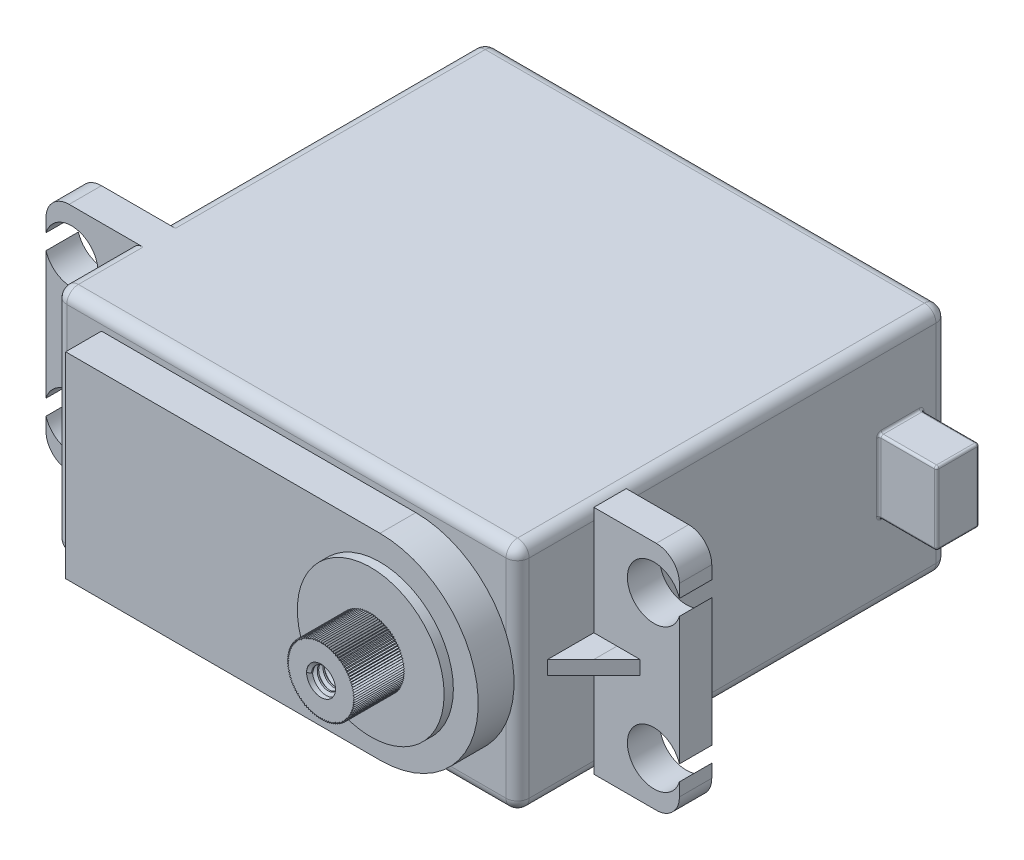
from build123d import *
from build123d.topology import SkipClean

# Parameters (mm, degrees)
SKETCH1_W            = 40
SKETCH1_H            = 20
BOSS_EXTRUDE1_DEPTH  = 37.2
SKETCH2_W            = 2.8
SKETCH2_H            = 20
BOSS_EXTRUDE2_DEPTH  = 7.4
SKETCH3_R            = 2.3
CUT_EXTRUDE1_DEPTH   = 43.274342
FILLET1_R            = 2
RIB5_OUTLINE_W       = 4
RIB5_OUTLINE_H       = 1.2
RIB5_DEPTH           = 4
CUT_EXTRUDE2_DEPTH   = 48.40211
SKETCH6_W            = 3.7
SKETCH6_H            = 6.3
BOSS_EXTRUDE3_DEPTH  = 5
FILLET3_R            = 1
BOSS_EXTRUDE4_DEPTH  = 3.1
SKETCH8_R            = 6.35
BOSS_EXTRUDE5_DEPTH  = 0.8
BOSS_EXTRUDE6_DEPTH  = 4.3
SKETCH10_R           = 1.25
CUT_EXTRUDE3_DEPTH   = 6
THREAD1_PITCH        = 0.5
FILLET1_OF_MIRROR1_R = 2
FILLET4_R            = 0.2


# Read off the part's stored shape, not the designer's step: Rib5
with BuildPart() as part:
    # Sketch1 → Boss-Extrude1 (new body)
    with BuildSketch(Plane.XY):
        Rectangle(SKETCH1_W, SKETCH1_H)
    extrude(amount=BOSS_EXTRUDE1_DEPTH)

    # Sketch2 → Boss-Extrude2 (add)
    with BuildSketch(Plane.ZY.offset(20)):
        with Locations((29.2, 0)):
            Rectangle(SKETCH2_W, SKETCH2_H)
    boss_extrude2 = extrude(amount=BOSS_EXTRUDE2_DEPTH)

    # Sketch3 → Cut-Extrude1 (cut, through all)
    with BuildSketch(Plane.XY.offset(30.6)):
        with Locations((-25.2, 6.2)):
            Circle(SKETCH3_R)
        with Locations((-25.2, -6.2)):
            Circle(SKETCH3_R)
    cut_extrude1 = extrude(amount=-CUT_EXTRUDE1_DEPTH, mode=Mode.SUBTRACT)

    # Fillet1
    fillet1_edges = [part.edges().sort_by_distance(p)[0] for p in [
        (-27.4, -10, 29.2),
        (-27.4, 10, 29.2),
    ]]
    fillet(fillet1_edges, radius=FILLET1_R)

    # Rib5 outline → Rib5 (add)
    with BuildSketch(Plane.XY.offset(30.6)):
        with Locations((-22, 0)):
            Rectangle(RIB5_OUTLINE_W, RIB5_OUTLINE_H)
    rib5 = extrude(amount=RIB5_DEPTH)

    # Sketch5 → Cut-Extrude2 (cut, through all)
    with BuildSketch(Plane.XZ.offset(0.6)):
        Polygon((-24, 34.6), (-24, 30.6), (-20, 34.6), align=None)
    cut_extrude2 = extrude(amount=-CUT_EXTRUDE2_DEPTH, mode=Mode.SUBTRACT)

    # Sketch6 → Boss-Extrude3 (add)
    with BuildSketch(Plane.ZY.offset(-20)):
        with Locations((4.098205, 0)):
            Rectangle(SKETCH6_W, SKETCH6_H)
    extrude(amount=-BOSS_EXTRUDE3_DEPTH)

    # Fillet3
    fillet3_edges = [part.edges().sort_by_distance(p)[0] for p in [
        (-20, 0, 37.2),
        (-20, -10, 13.9),
        (-20, 10, 13.9),
        (0, -10, 37.2),
        (20, 0, 37.2),
        (0, -10, 0),
        (-20, 0, 0),
        (0, 10, 0),
        (20, 0, 0),
        (20, -10, 18.6),
        (-20, -10, 33.9),
        (-20, 10, 33.9),
        (20, 10, 18.6),
        (0, 10, 37.2),
    ]]
    fillet(fillet3_edges, radius=FILLET3_R)

    # Sketch7 → Boss-Extrude4 (add)
    with BuildSketch(Plane.XY.offset(37.2)):
        with BuildLine():
            Line((-16, 8.5), (11.194571, 8.5))
            ThreePointArc((11.194571, 8.5), (19.694571, 0), (11.194571, -8.5))
            Line((11.194571, -8.5), (-16, -8.5))
            Line((-16, -8.5), (-16, 8.5))
        make_face()
    extrude(amount=BOSS_EXTRUDE4_DEPTH)

    # Sketch8 → Boss-Extrude5 (add)
    with BuildSketch(Plane.XY.offset(40.3)):
        with Locations((11.194571, 0)):
            Circle(SKETCH8_R)
    extrude(amount=BOSS_EXTRUDE5_DEPTH)

    # Sketch9 → Boss-Extrude6 (add)
    with BuildSketch(Plane.XY.offset(41.1)):
        Polygon((11.194571, 2.941835), (11.107151, 2.798635), (11.010911, 2.936063), (10.932655, 2.787657), (10.827976, 2.918771), (10.759192, 2.765743), (10.646487, 2.890026), (10.587448, 2.732981), (10.467162, 2.849942), (10.4181, 2.6895), (10.290707, 2.798677), (10.251816, 2.635471), (10.117819, 2.736434), (10.089253, 2.571108), (9.949181, 2.663457), (9.931052, 2.496664), (9.785458, 2.580036), (9.777838, 2.412434), (9.627296, 2.486499), (9.630215, 2.318749), (9.475319, 2.383216), (9.488766, 2.215981), (9.330128, 2.270594), (9.354048, 2.104533), (9.192294, 2.149078), (9.226595, 1.984846), (9.062363, 2.019146), (9.106908, 1.857392), (8.940846, 1.881313), (8.99546, 1.722675), (8.828224, 1.736121), (8.892691, 1.581226), (8.724941, 1.584144), (8.799006, 1.433602), (8.631404, 1.425982), (8.714776, 1.280388), (8.547983, 1.262259), (8.640332, 1.122187), (8.475007, 1.093621), (8.575969, 0.959624), (8.412763, 0.920733), (8.52194, 0.79334), (8.361499, 0.744279), (8.478459, 0.623992), (8.321415, 0.564953), (8.445697, 0.452248), (8.29267, 0.383465), (8.423784, 0.278786), (8.275377, 0.20053), (8.412805, 0.10429), (8.269605, 0.016869), (8.412805, -0.070551), (8.275377, -0.166791), (8.423784, -0.245047), (8.29267, -0.349726), (8.445697, -0.418509), (8.321415, -0.531214), (8.478459, -0.590254), (8.361499, -0.71054), (8.52194, -0.759602), (8.412763, -0.886995), (8.575969, -0.925885), (8.475007, -1.059882), (8.640332, -1.088448), (8.547983, -1.22852), (8.714776, -1.246649), (8.631404, -1.392243), (8.799006, -1.399864), (8.724941, -1.550406), (8.892691, -1.547487), (8.828224, -1.702382), (8.99546, -1.688936), (8.940846, -1.847574), (9.106908, -1.823653), (9.062363, -1.985407), (9.226595, -1.951107), (9.192294, -2.115339), (9.354048, -2.070794), (9.330128, -2.236855), (9.488766, -2.182242), (9.475319, -2.349477), (9.630215, -2.285011), (9.627296, -2.452761), (9.777838, -2.378695), (9.785458, -2.546297), (9.931052, -2.462925), (9.949181, -2.629719), (10.089253, -2.537369), (10.117819, -2.702695), (10.251816, -2.601732), (10.290707, -2.764938), (10.4181, -2.655761), (10.467162, -2.816203), (10.587448, -2.699242), (10.646487, -2.856287), (10.759192, -2.732004), (10.827976, -2.885032), (10.932655, -2.753918), (11.010911, -2.902324), (11.107151, -2.764896), (11.194571, -2.908096), (11.281992, -2.764896), (11.378231, -2.902324), (11.456488, -2.753918), (11.561166, -2.885032), (11.62995, -2.732004), (11.742655, -2.856287), (11.801694, -2.699242), (11.92198, -2.816203), (11.971042, -2.655761), (12.098435, -2.764938), (12.137326, -2.601732), (12.271323, -2.702695), (12.299889, -2.537369), (12.439961, -2.629719), (12.45809, -2.462925), (12.603684, -2.546297), (12.611304, -2.378695), (12.761846, -2.452761), (12.758927, -2.285011), (12.913823, -2.349477), (12.900376, -2.182242), (13.059014, -2.236855), (13.035094, -2.070794), (13.196848, -2.115339), (13.162547, -1.951107), (13.326779, -1.985407), (13.282234, -1.823653), (13.448296, -1.847574), (13.393682, -1.688936), (13.560918, -1.702382), (13.496451, -1.547487), (13.664201, -1.550406), (13.590136, -1.399864), (13.757738, -1.392243), (13.674366, -1.246649), (13.841159, -1.22852), (13.74881, -1.088448), (13.914135, -1.059882), (13.813173, -0.925885), (13.976379, -0.886995), (13.867202, -0.759602), (14.027643, -0.71054), (13.910683, -0.590254), (14.067727, -0.531214), (13.943445, -0.418509), (14.096472, -0.349726), (13.965358, -0.245047), (14.113765, -0.166791), (13.976337, -0.070551), (14.119537, 0.016869), (13.976337, 0.10429), (14.113765, 0.20053), (13.965358, 0.278786), (14.096472, 0.383465), (13.943445, 0.452248), (14.067727, 0.564953), (13.910683, 0.623992), (14.027643, 0.744279), (13.867202, 0.79334), (13.976379, 0.920733), (13.813173, 0.959624), (13.914135, 1.093621), (13.74881, 1.122187), (13.841159, 1.262259), (13.674366, 1.280388), (13.757738, 1.425982), (13.590136, 1.433602), (13.664201, 1.584144), (13.496451, 1.581226), (13.560918, 1.736121), (13.393682, 1.722675), (13.448296, 1.881313), (13.282234, 1.857392), (13.326779, 2.019146), (13.162547, 1.984846), (13.196848, 2.149078), (13.035094, 2.104533), (13.059014, 2.270594), (12.900376, 2.215981), (12.913823, 2.383216), (12.758927, 2.318749), (12.761846, 2.486499), (12.611304, 2.412434), (12.603684, 2.580036), (12.45809, 2.496664), (12.439961, 2.663457), (12.299889, 2.571108), (12.271323, 2.736434), (12.137326, 2.635471), (12.098435, 2.798677), (11.971042, 2.6895), (11.92198, 2.849942), (11.801694, 2.732981), (11.742655, 2.890026), (11.62995, 2.765743), (11.561166, 2.918771), (11.456488, 2.787657), (11.378231, 2.936063), (11.281992, 2.798635), align=None)
    extrude(amount=BOSS_EXTRUDE6_DEPTH)

    # Sketch10 → Cut-Extrude3 (cut)
    with BuildSketch(Plane.XY.offset(45.4)):
        with Locations((11.194571, 0)):
            Circle(SKETCH10_R)
    extrude(amount=-CUT_EXTRUDE3_DEPTH, mode=Mode.SUBTRACT)

    # Thread1: the profile of Thread Profile1 profile screwed along a right-hand helix of 12 turns, 6 arcs to a turn; built about Z, then put on its axis
    with SkipClean():  # the faces are left unmerged after this step: merging them gives an invalid solid
        thread1_z = Axis((0, 0, 0), (0, 0, 1))
        thread1_corners = [(1.2503, 0, -0.000173), (1.2503, 0, 0.437673), (0.979367, 0, 0.28125), (0.979367, 0, 0.15625)]
        with BuildLine(mode=Mode.PRIVATE) as thread1_profile:
            Line(thread1_corners[0], thread1_corners[1])
            Line(thread1_corners[1], thread1_corners[2])
            Line(thread1_corners[2], thread1_corners[3])
            Line(thread1_corners[3], thread1_corners[0])
        thread1_cap = Face(thread1_profile.wire())
        thread1_turn_angles = [0, 30, 60, 90, 120, 150, 180, 210, 240, 270, 300, 330, 360]
        thread1_turn_weights = [1, 0.8660254037844387, 1, 0.8660254037844387, 1, 0.8660254037844387, 1, 0.8660254037844387, 1, 0.8660254037844387, 1, 0.8660254037844387, 1]
        thread1_turn_rails = [Edge.make_bspline([Vector(p[0], p[1], 0).rotate(thread1_z, thread1_turn_angles[k]) / thread1_turn_weights[k] + Vector(0, 0, p[2] + THREAD1_PITCH * thread1_turn_angles[k] / 360) for k in range(13)], [0, 0, 0, 1, 1, 2, 2, 3, 3, 4, 4, 5, 5, 6, 6, 6], 2, thread1_turn_weights) for p in thread1_corners]
        thread1_turn_sides = [Face.make_surface_from_curves(thread1_turn_rails[p[0]], thread1_turn_rails[p[1]]) for p in [(0, 1), (1, 2), (2, 3), (3, 0)]]
        thread1 = Plane(origin=(11.194571, 0, 45.4), x_dir=(-1, 0, 0), z_dir=(0, 0, -1)) * Solid(Shell([*[p.moved(Location((0, 0, THREAD1_PITCH * i))) for i in range(12) for p in thread1_turn_sides], thread1_cap, thread1_cap.rotate(thread1_z, 4320).moved(Location((0, 0, THREAD1_PITCH * 4320 / 360)))]))
        add(thread1)

    # Mirror1: Boss-Extrude2, Cut-Extrude1, Rib5, Cut-Extrude2 across plane
    with SkipClean():  # the faces are left unmerged after this step: merging them gives an invalid solid
        add(boss_extrude2.mirror(Plane(origin=(0, 0, 0), x_dir=(0, 0, 1), z_dir=(1, 0, 0))))
        add(cut_extrude1.mirror(Plane(origin=(0, 0, 0), x_dir=(0, 0, 1), z_dir=(1, 0, 0))), mode=Mode.SUBTRACT)
        add(rib5.mirror(Plane(origin=(0, 0, 0), x_dir=(0, 0, 1), z_dir=(1, 0, 0))))
        add(cut_extrude2.mirror(Plane(origin=(0, 0, 0), x_dir=(0, 0, 1), z_dir=(1, 0, 0))), mode=Mode.SUBTRACT)

    # Fillet1 of Mirror1
    fillet1_of_mirror1_edges = [part.edges().sort_by_distance(p)[0] for p in [
        (27.4, -10, 29.2),
        (27.4, 10, 29.2),
    ]]
    fillet(fillet1_of_mirror1_edges, radius=FILLET1_OF_MIRROR1_R)

    # Fillet4
    fillet4_edges = [part.edges().sort_by_distance(p)[0] for p in [
        (25, 0, 5.948205),
        (22.5, 3.15, 5.948205),
        (25, -3.15, 4.098205),
        (22.5, -3.15, 5.948205),
        (25, 0, 2.248205),
        (22.5, -3.15, 2.248205),
        (25, 3.15, 4.098205),
        (22.5, 3.15, 2.248205),
        (20, 0, 5.948205),
        (20, 3.15, 4.098205),
        (20, 0, 2.248205),
        (20, -3.15, 4.098205),
    ]]
    fillet(fillet4_edges, radius=FILLET4_R)


solid = part.part
